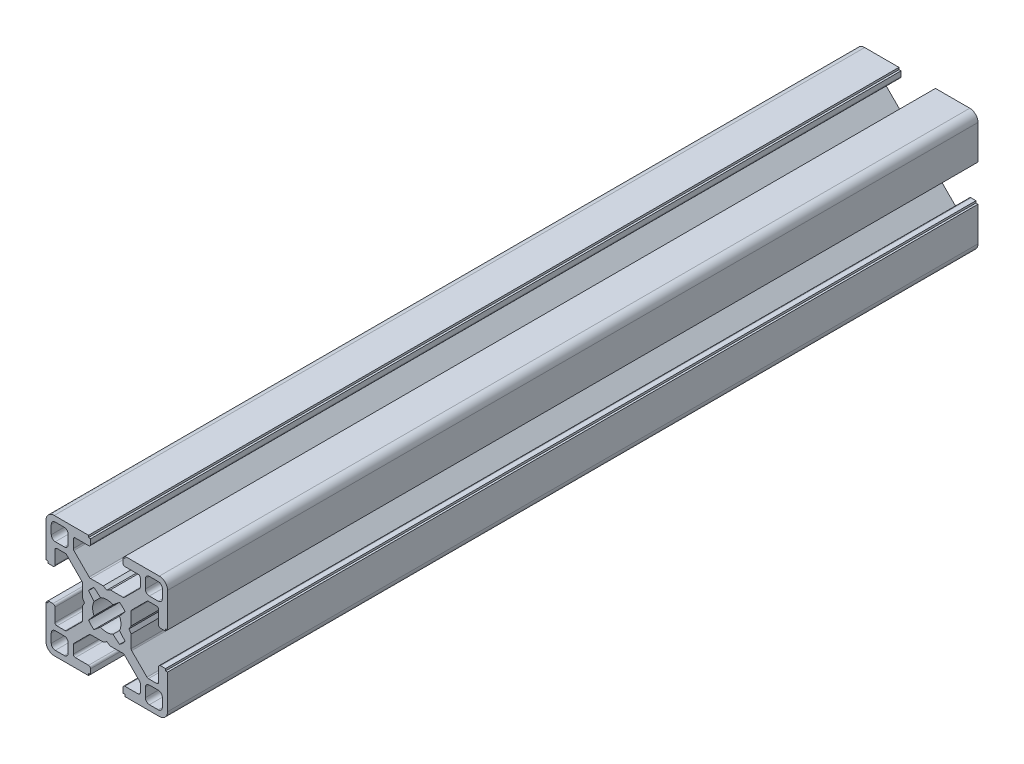
from build123d import *

# Parameters (mm, degrees)
BOSS_EXTRUDE1_DEPTH = 100
CIRPATTERN1_COUNT   = 4


with BuildPart() as part:
    # Sketch3 → Boss-Extrude1 (new, symmetric)
    with BuildSketch(Plane.XY):
        with BuildLine():
            Line((-4.503841895, 3.156803476), (-3.14772708, 1.530298739))
            ThreePointArc((-3.14772708, 1.530298739), (-3.410794979, 0.785160882), (-3.5, 0))
            Line((-3.5, 0), (-5.5, 0))
            Line((-5.5, 0), (-6, 0.866025404))
            Line((-6, 0.866025404), (-6, 3.996841995))
            ThreePointArc((-6, 3.996841995), (-6.038060234, 4.188183711), (-6.146446609, 4.350395385))
            Line((-6.146446609, 4.350395385), (-9.917104615, 8.121053391))
            ThreePointArc((-9.917104615, 8.121053391), (-10.079316289, 8.229439766), (-10.270658005, 8.2675))
            Line((-10.270658005, 8.2675), (-12.29, 8.2675))
            ThreePointArc((-12.29, 8.2675), (-12.643553391, 8.121053391), (-12.79, 7.7675))
            Line((-12.79, 7.7675), (-12.79, 4.5))
            ThreePointArc((-12.79, 4.5), (-12.936446609, 4.146446609), (-13.29, 4))
            Line((-13.29, 4), (-14.5, 4))
            Line((-14.5, 4), (-14.5, 4.5))
            Line((-14.5, 4.5), (-15, 4.5))
            Line((-15, 4.5), (-15, 12.968))
            ThreePointArc((-15, 12.968), (-14.404840979, 14.404840979), (-12.968, 15))
            Line((-12.968, 15), (-4.5, 15))
            Line((-4.5, 15), (-4.5, 14.5))
            Line((-4.5, 14.5), (-4, 14.5))
            Line((-4, 14.5), (-4, 13.29))
            ThreePointArc((-4, 13.29), (-4.146446609, 12.936446609), (-4.5, 12.79))
            Line((-4.5, 12.79), (-7.7675, 12.79))
            ThreePointArc((-7.7675, 12.79), (-8.121053391, 12.643553391), (-8.2675, 12.29))
            Line((-8.2675, 12.29), (-8.2675, 10.270658005))
            ThreePointArc((-8.2675, 10.270658005), (-8.229439766, 10.079316289), (-8.121053391, 9.917104615))
            Line((-8.121053391, 9.917104615), (-4.350395385, 6.146446609))
            ThreePointArc((-4.350395385, 6.146446609), (-4.188183711, 6.038060234), (-3.996841995, 6))
            Line((-3.996841995, 6), (-0.866025404, 6))
            Line((-0.866025404, 6), (0, 5.5))
            Line((0, 5.5), (0, 3.5))
            ThreePointArc((0, 3.5), (-0.785160882, 3.410794979), (-1.530298739, 3.14772708))
            Line((-1.530298739, 3.14772708), (-3.156803476, 4.503841895))
            ThreePointArc((-3.156803476, 4.503841895), (-3.889087297, 3.889087297), (-4.503841895, 3.156803476))
        make_face()
        with BuildLine():
            Line((-12.705, 9.5135), (-10.5135, 9.5135))
            ThreePointArc((-10.5135, 9.5135), (-9.806393219, 9.806393219), (-9.5135, 10.5135))
            Line((-9.5135, 10.5135), (-9.5135, 12.705))
            ThreePointArc((-9.5135, 12.705), (-9.806393219, 13.412106781), (-10.5135, 13.705))
            Line((-10.5135, 13.705), (-12.705, 13.705))
            ThreePointArc((-12.705, 13.705), (-13.412106781, 13.412106781), (-13.705, 12.705))
            Line((-13.705, 12.705), (-13.705, 10.5135))
            ThreePointArc((-13.705, 10.5135), (-13.412106781, 9.806393219), (-12.705, 9.5135))
        make_face(mode=Mode.SUBTRACT)
    boss_extrude1 = extrude(amount=BOSS_EXTRUDE1_DEPTH, both=True)

    # CirPattern1: Boss-Extrude1 ×4 about axis
    cirpattern1_axis = Axis((0, 0, 76.2), (0, 0, -1))
    for i in range(1, CIRPATTERN1_COUNT):
        add(boss_extrude1.rotate(cirpattern1_axis, i * 360 / CIRPATTERN1_COUNT))


solid = part.part
